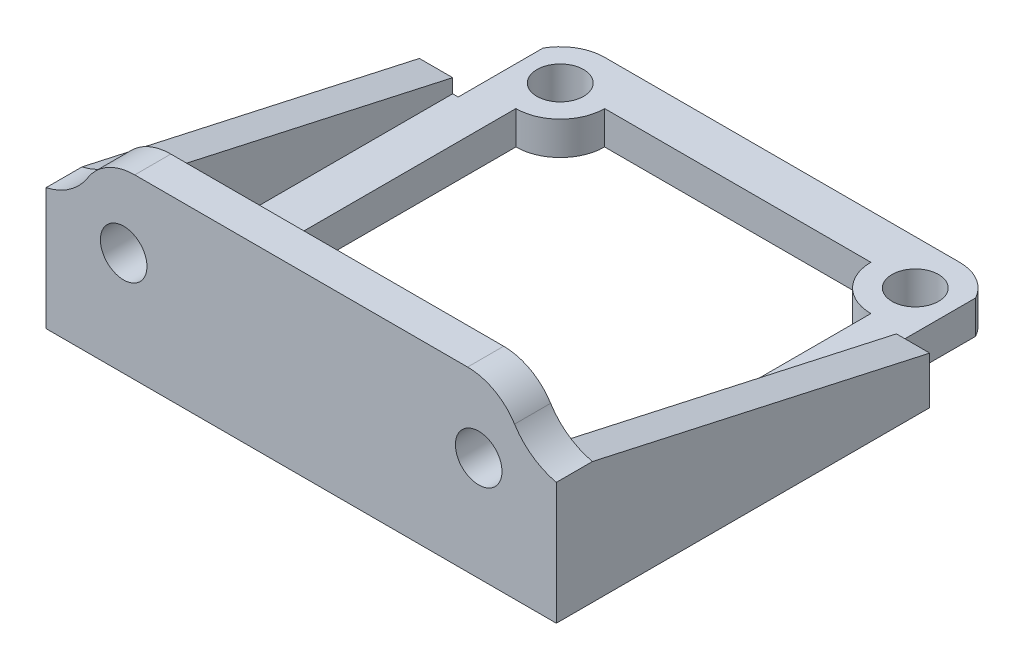
from build123d import *

# Parameters (mm, degrees)
SKETCH1_R           = 2.1
BOSS_EXTRUDE1_DEPTH = 3
SKETCH2_W           = 40
SKETCH2_H           = 3.25
BOSS_EXTRUDE2_DEPTH = 13
SKETCH3_R           = 2.1
CUT_EXTRUDE1_DEPTH  = 15
FILLET1_R           = 5
BOSS_EXTRUDE3_DEPTH = 3
BOSS_EXTRUDE4_DEPTH = 3
FILLET4_R           = 6
SKETCH7_W           = 3.5
SKETCH7_H           = 9.863589554
CUT_EXTRUDE2_DEPTH  = 10
SKETCH8_W           = 3
SKETCH8_H           = 1.69787118
CUT_EXTRUDE3_DEPTH  = 10


with BuildPart() as part:
    # Sketch1 → Boss-Extrude1 (new body)
    with BuildSketch(Plane(origin=(0, 0, 0), x_dir=(1, 0, 0), z_dir=(0, 1, 0))):
        with BuildLine():
            Line((0, 20), (32, 20))
            ThreePointArc((32, 20), (34.828427125, 18.828427125), (36, 16))
            Line((36, 16), (36, -16))
            Line((36, -16), (36, -23.351584796))
            Line((36, -23.351584796), (-4, -23.351584796))
            Line((-4, -23.351584796), (-4, -16))
            Line((-4, -16), (-4, 16))
            ThreePointArc((-4, 16), (-2.828427125, 18.828427125), (0, 20))
        make_face()
        with Locations(Location((0, 16, 0), (0, 0, 270))):
            Circle(SKETCH1_R, mode=Mode.SUBTRACT)
        with Locations(Location((0, -16, 0), (0, 0, 270))):
            Circle(SKETCH1_R, mode=Mode.SUBTRACT)
        with Locations(Location((32, 16, 0), (0, 0, 270))):
            Circle(SKETCH1_R, mode=Mode.SUBTRACT)
        with Locations(Location((32, -16, 0), (0, 0, 270))):
            Circle(SKETCH1_R, mode=Mode.SUBTRACT)
        with BuildLine():
            Line((0, 12), (0, -12))
            ThreePointArc((0, -12), (2.828427125, -13.171572875), (4, -16))
            Line((4, -16), (28, -16))
            ThreePointArc((28, -16), (29.171572875, -13.171572875), (32, -12))
            Line((32, -12), (32, 12))
            ThreePointArc((32, 12), (29.171572875, 13.171572875), (28, 16))
            Line((28, 16), (4, 16))
            ThreePointArc((4, 16), (2.828427125, 13.171572875), (0, 12))
        make_face(mode=Mode.SUBTRACT)
    extrude(amount=BOSS_EXTRUDE1_DEPTH)

    # Sketch2 → Boss-Extrude2 (add)
    with BuildSketch(Plane(origin=(0, 3, 0), x_dir=(1, 0, 0), z_dir=(0, 1, 0))):
        with Locations((16, -21.726584796)):
            Rectangle(SKETCH2_W, SKETCH2_H)
    extrude(amount=BOSS_EXTRUDE2_DEPTH)

    # Sketch3 → Cut-Extrude1 (cut)
    with BuildSketch(Plane(origin=(0, 0, 20.101584796), x_dir=(-1, 0, 0), z_dir=(0, 0, -1))):
        with Locations((-0.000616802, 9.396216068)):
            Circle(SKETCH3_R)
        with Locations((-31.999383198, 9.396216068)):
            Circle(SKETCH3_R)
    extrude(amount=-CUT_EXTRUDE1_DEPTH, mode=Mode.SUBTRACT)

    # Fillet1
    fillet1_edges = [part.edges().sort_by_distance(p)[0] for p in [
        (-4, 16, 21.726584796),
        (36, 16, 21.726584796),
    ]]
    fillet(fillet1_edges, radius=FILLET1_R)

    # Sketch4 → Boss-Extrude3 (add)
    with BuildSketch(Plane(origin=(36, 0, 0), x_dir=(0, 0, -1), z_dir=(1, 0, 0))):
        Polygon((-20.101584796, 11), (12, 3.88638768), (12, 0), (-23.351584796, 0), (-23.351584796, 11), align=None)
    extrude(amount=BOSS_EXTRUDE3_DEPTH)

    # Sketch5 → Boss-Extrude4 (add)
    with BuildSketch(Plane.ZY.offset(4)):
        Polygon((20.101584796, 11), (23.351584796, 11), (23.351584796, 0), (-12, 0), (-12, 3.88638768), align=None)
    extrude(amount=BOSS_EXTRUDE4_DEPTH)

    # Fillet4
    # the kernel refuses this fillet: 6 mm, written as the material it adds along each edge
    with BuildSketch(Plane(origin=(36, 11, 23.351584796), x_dir=(1, 0, 0), z_dir=(0, 0, -1))) as fillet4_piece_1:
        with BuildLine():
            CenterArc((4.3125, -5.854685623), FILLET4_R, 102.635625093, 45.207166298)
            ThreePointArc((-0.767045455, -2.661220738), (-0.195586783, -1.384779274), (0, 0))
            Line((0, 0), (3, 0))
        make_face()
    extrude(amount=3.25)
    with BuildSketch(Plane(origin=(-4, 11, 20.101584796), x_dir=(0.2769558547034986, 0.9608826434822593, 0), z_dir=(0, 0, 1))) as fillet4_piece_2:
        with BuildLine():
            CenterArc((4.431293675, 5.765295861), FILLET4_R, 208.714229398, 45.207166298)
            Line((-0.830867564, 2.88264793), (0, 0))
            ThreePointArc((0, 0), (1.384779274, 0.195586783), (2.769558547, 0))
        make_face()
    extrude(amount=3.25)

    # Sketch7 → Cut-Extrude2 (cut)
    with BuildSketch(Plane(origin=(0, 3, 0), x_dir=(1, 0, 0), z_dir=(0, 1, 0))):
        with Locations((-5.25, 15.233923597)):
            Rectangle(SKETCH7_W, SKETCH7_H)
        with Locations((37.25, 15.233923597)):
            Rectangle(SKETCH7_W, SKETCH7_H)
    extrude(amount=-CUT_EXTRUDE2_DEPTH, mode=Mode.SUBTRACT)

    # Sketch8 → Cut-Extrude3 (cut)
    with BuildSketch(Plane(origin=(0, 3, 0), x_dir=(-1, 0, 0), z_dir=(0, -1, 0))):
        with Locations((5.5, 11.15106441)):
            Rectangle(SKETCH8_W, SKETCH8_H)
        with Locations((-37.5, 11.15106441)):
            Rectangle(SKETCH8_W, SKETCH8_H)
    extrude(amount=-CUT_EXTRUDE3_DEPTH, mode=Mode.SUBTRACT)


solid = part.part
